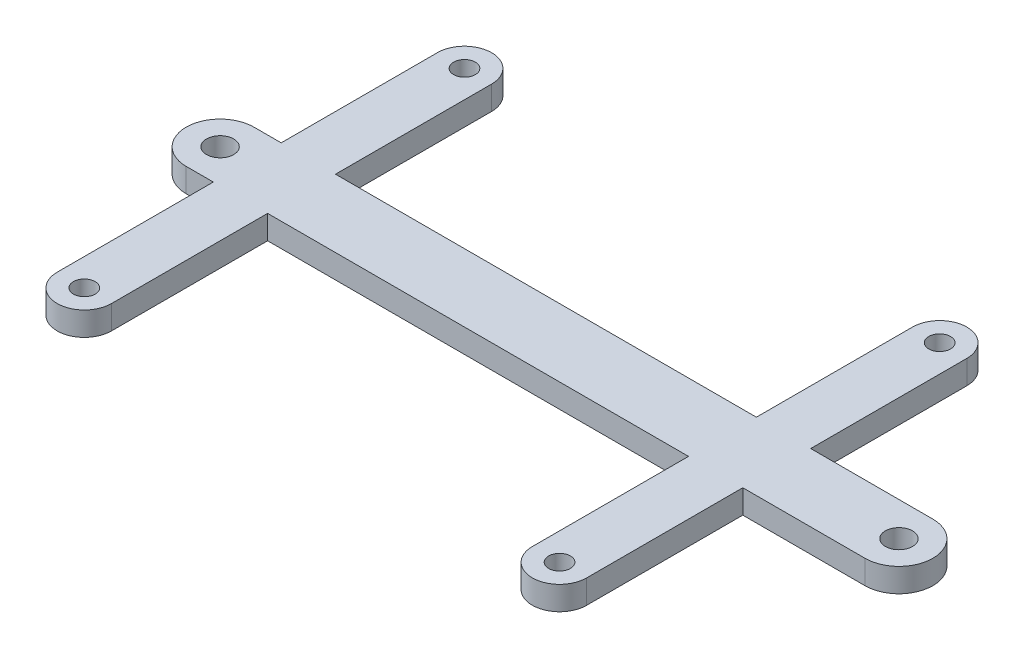
from build123d import *

# Parameters (mm, degrees)
SKETCH1_R           = 1.6
SKETCH1_R_2         = 2
BOSS_EXTRUDE1_DEPTH = 3.5


with BuildPart() as part:
    # Sketch1 → Boss-Extrude1 (new body)
    with BuildSketch(Plane(origin=(0, 0, 0), x_dir=(1, 0, 0), z_dir=(0, 1, 0))):
        with BuildLine():
            Line((32, 5), (32, 28))
            ThreePointArc((32, 28), (28, 32), (24, 28))
            Line((24, 28), (24, 5))
            Line((24, 5), (-38, 5))
            Line((-38, 5), (-38, 28))
            ThreePointArc((-38, 28), (-42, 32), (-46, 28))
            Line((-46, 28), (-46, 5))
            Line((-46, 5), (-50, 5))
            ThreePointArc((-50, 5), (-55, 0), (-50, -5))
            Line((-50, -5), (-46, -5))
            Line((-46, -5), (-46, -28))
            ThreePointArc((-46, -28), (-42, -32), (-38, -28))
            Line((-38, -28), (-38, -5))
            Line((-38, -5), (24, -5))
            Line((24, -5), (24, -28))
            ThreePointArc((24, -28), (28, -32), (32, -28))
            Line((32, -28), (32, -5))
            Line((32, -5), (50, -5))
            ThreePointArc((50, -5), (55, 0), (50, 5))
            Line((50, 5), (32, 5))
        make_face()
        with Locations((-42, -28)):
            Circle(SKETCH1_R, mode=Mode.SUBTRACT)
        with Locations((28, -28)):
            Circle(SKETCH1_R, mode=Mode.SUBTRACT)
        with Locations((-50, 0)):
            Circle(SKETCH1_R_2, mode=Mode.SUBTRACT)
        with Locations((-42, 28)):
            Circle(SKETCH1_R, mode=Mode.SUBTRACT)
        with Locations((50, 0)):
            Circle(SKETCH1_R_2, mode=Mode.SUBTRACT)
        with Locations((28, 28)):
            Circle(SKETCH1_R, mode=Mode.SUBTRACT)
    extrude(amount=BOSS_EXTRUDE1_DEPTH)


solid = part.part
